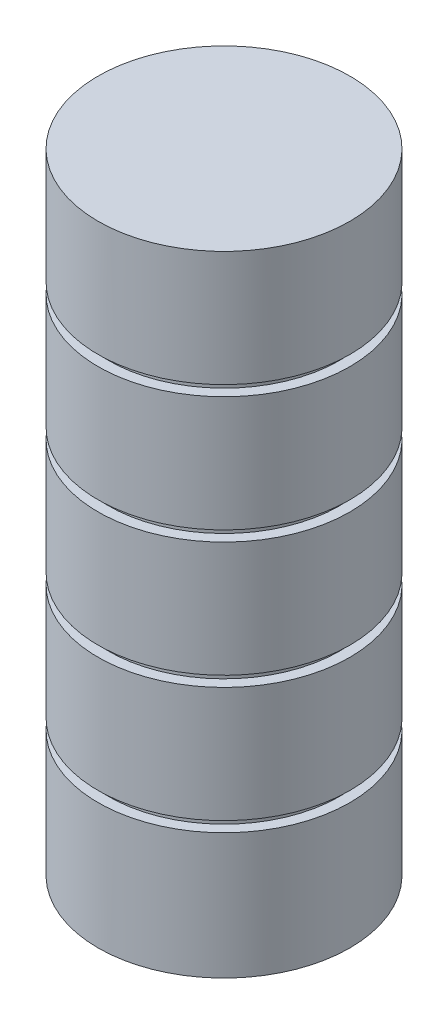
from build123d import *

# Parameters (mm, degrees)
SKETCH1_R             = 6
BOSS_EXTRUDE1_DEPTH   = 30
SKETCH2_W             = 0.5
SKETCH2_H             = 0.5
M6_TAPPED_HOLE1_D     = 5
M6_TAPPED_HOLE1_DEPTH = 12
M6_TAPPED_HOLE1_TIP   = 1.502151548
THREAD1_PITCH         = 1


with BuildPart() as part:
    # Sketch1 → Boss-Extrude1 (new body)
    with BuildSketch(Plane(origin=(0, 0, 0), x_dir=(1, 0, 0), z_dir=(0, 1, 0))):
        with Locations(Location((0, 0, 0), (0, 0, 270))):
            Circle(SKETCH1_R)
    extrude(amount=BOSS_EXTRUDE1_DEPTH)

    # Sketch2 → Cut-Revolve1 (revolve, cut)
    with BuildSketch(Plane.XY):
        with Locations((5.75, 6.25)):
            Rectangle(SKETCH2_W, SKETCH2_H)
        with Locations((5.75, 12.25)):
            Rectangle(SKETCH2_W, SKETCH2_H)
        with Locations((5.75, 18.25)):
            Rectangle(SKETCH2_W, SKETCH2_H)
        with Locations((5.75, 24.25)):
            Rectangle(SKETCH2_W, SKETCH2_H)
    revolve(axis=Axis((0, 0, 0), (0, 1, 0)), mode=Mode.SUBTRACT)

    # M6 Tapped Hole1
    with Locations(Plane(origin=(0, 0, 0), x_dir=(-1, 0, 0), z_dir=(0, -1, 0))):
        with Locations((0, 0)):
            Hole(M6_TAPPED_HOLE1_D / 2, depth=M6_TAPPED_HOLE1_DEPTH)
            with Locations((0, 0, -(M6_TAPPED_HOLE1_DEPTH + M6_TAPPED_HOLE1_TIP / 2))):  # 118° drill point
                Cone(0, M6_TAPPED_HOLE1_D / 2, M6_TAPPED_HOLE1_TIP, mode=Mode.SUBTRACT)

    # Thread1: the profile of Thread Profile1 profile screwed along a right-hand helix of 12 turns, 8 arcs to a turn; built about Z, then put on its axis
    thread1_z = Axis((0, 0, 0), (0, 0, 1))
    thread1_corners = [(2.4997, 0, -0.000173205), (3.041265875, 0, 0.312499999), (3.041265875, 0, 0.437499999), (2.4997, 0, 0.750173202)]
    with BuildLine(mode=Mode.PRIVATE) as thread1_profile:
        Line(thread1_corners[0], thread1_corners[1])
        Line(thread1_corners[1], thread1_corners[2])
        Line(thread1_corners[2], thread1_corners[3])
        Line(thread1_corners[3], thread1_corners[0])
    thread1_cap = Face(thread1_profile.wire())
    thread1_turn_angles = [0, 22.5, 45, 67.5, 90, 112.5, 135, 157.5, 180, 202.5, 225, 247.5, 270, 292.5, 315, 337.5, 360]
    thread1_turn_weights = [1, 0.9238795325112867, 1, 0.9238795325112867, 1, 0.9238795325112867, 1, 0.9238795325112867, 1, 0.9238795325112867, 1, 0.9238795325112867, 1, 0.9238795325112867, 1, 0.9238795325112867, 1]
    thread1_turn_rails = [Edge.make_bspline([Vector(p[0], p[1], 0).rotate(thread1_z, thread1_turn_angles[k]) / thread1_turn_weights[k] + Vector(0, 0, p[2] + THREAD1_PITCH * thread1_turn_angles[k] / 360) for k in range(17)], [0, 0, 0, 1, 1, 2, 2, 3, 3, 4, 4, 5, 5, 6, 6, 7, 7, 8, 8, 8], 2, thread1_turn_weights) for p in thread1_corners]
    thread1_turn_sides = [Face.make_surface_from_curves(thread1_turn_rails[p[0]], thread1_turn_rails[p[1]]) for p in [(0, 1), (1, 2), (2, 3), (3, 0)]]
    thread1 = Plane(origin=(0, 12, 0), x_dir=(-1, 0, 0), z_dir=(0, -1, 0)) * Solid(Shell([*[p.moved(Location((0, 0, THREAD1_PITCH * i))) for i in range(12) for p in thread1_turn_sides], thread1_cap, thread1_cap.rotate(thread1_z, 4320).moved(Location((0, 0, THREAD1_PITCH * 4320 / 360)))]))
    add(thread1, mode=Mode.SUBTRACT)


solid = part.part
